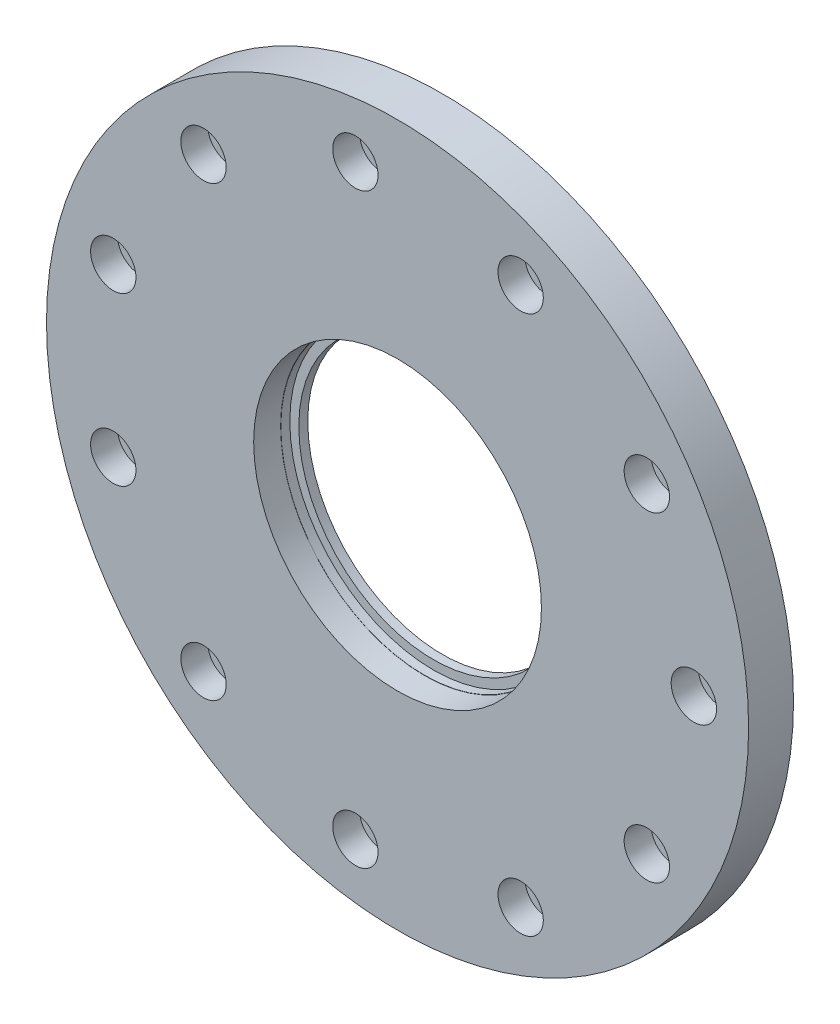
from build123d import *

# Parameters (mm, degrees)
SKETCH1_R           = 39.1
SKETCH1_R_2         = 2.525
SKETCH1_R_3         = 16.025
BOSS_EXTRUDE1_DEPTH = 3
BOSS_EXTRUDE2_START = 2
SKETCH2_R           = 39.1
SKETCH2_R_2         = 16
BOSS_EXTRUDE2_DEPTH = 2
SKETCH3_R           = 1.6
CUT_EXTRUDE1_DEPTH  = 56.521347246
SKETCH4_R           = 16
SKETCH4_R_2         = 15
BOSS_EXTRUDE3_DEPTH = 1


with BuildPart() as part:
    # Sketch1 → Boss-Extrude1 (new body)
    with BuildSketch(Plane.XY):
        Circle(SKETCH1_R)
        with Locations((33, 0)):
            Circle(SKETCH1_R_2, mode=Mode.SUBTRACT)
        with Locations((27.761366583, -17.841146976)):
            Circle(SKETCH1_R_2, mode=Mode.SUBTRACT)
        with Locations((13.708695429, -30.017855847)):
            Circle(SKETCH1_R_2, mode=Mode.SUBTRACT)
        with Locations((-4.696389663, -32.664107582)):
            Circle(SKETCH1_R_2, mode=Mode.SUBTRACT)
        with Locations((-21.61040422, -24.939735954)):
            Circle(SKETCH1_R_2, mode=Mode.SUBTRACT)
        with Locations((-31.663268129, -9.297174376)):
            Circle(SKETCH1_R_2, mode=Mode.SUBTRACT)
        with Locations((-31.663268129, 9.297174376)):
            Circle(SKETCH1_R_2, mode=Mode.SUBTRACT)
        with Locations((-21.61040422, 24.939735954)):
            Circle(SKETCH1_R_2, mode=Mode.SUBTRACT)
        with Locations((-4.696389663, 32.664107582)):
            Circle(SKETCH1_R_2, mode=Mode.SUBTRACT)
        with Locations((13.708695429, 30.017855847)):
            Circle(SKETCH1_R_2, mode=Mode.SUBTRACT)
        with Locations((27.761366583, 17.841146976)):
            Circle(SKETCH1_R_2, mode=Mode.SUBTRACT)
        Circle(SKETCH1_R_3, mode=Mode.SUBTRACT)
    extrude(amount=BOSS_EXTRUDE1_DEPTH)

    # Sketch2 → Boss-Extrude2 (add)
    with BuildSketch(Plane(origin=(0, 0, 0), x_dir=(-1, 0, 0), z_dir=(0, 0, -1)).offset(BOSS_EXTRUDE2_START)):
        Circle(SKETCH2_R)
        Circle(SKETCH2_R_2, mode=Mode.SUBTRACT)
    extrude(amount=-BOSS_EXTRUDE2_DEPTH)

    # Sketch3 → Cut-Extrude1 (cut, through all)
    with BuildSketch(Plane.XY.offset(3)):
        with Locations((33, 0)):
            Circle(SKETCH3_R)
        with Locations((27.761366583, -17.841146976)):
            Circle(SKETCH3_R)
        with Locations((13.708695429, -30.017855847)):
            Circle(SKETCH3_R)
        with Locations((-4.696389663, -32.664107582)):
            Circle(SKETCH3_R)
        with Locations((-21.61040422, -24.939735954)):
            Circle(SKETCH3_R)
        with Locations((-31.663268129, -9.297174376)):
            Circle(SKETCH3_R)
        with Locations((-31.663268129, 9.297174376)):
            Circle(SKETCH3_R)
        with Locations((-21.61040422, 24.939735954)):
            Circle(SKETCH3_R)
        with Locations((-4.696389663, 32.664107582)):
            Circle(SKETCH3_R)
        with Locations((13.708695429, 30.017855847)):
            Circle(SKETCH3_R)
        with Locations((27.761366583, 17.841146976)):
            Circle(SKETCH3_R)
    extrude(amount=-CUT_EXTRUDE1_DEPTH, mode=Mode.SUBTRACT)

    # Sketch4 → Boss-Extrude3 (add)
    with BuildSketch(Plane(origin=(0, 0, -2), x_dir=(-1, 0, 0), z_dir=(0, 0, -1))):
        Circle(SKETCH4_R)
        Circle(SKETCH4_R_2, mode=Mode.SUBTRACT)
    extrude(amount=-BOSS_EXTRUDE3_DEPTH)


solid = part.part
